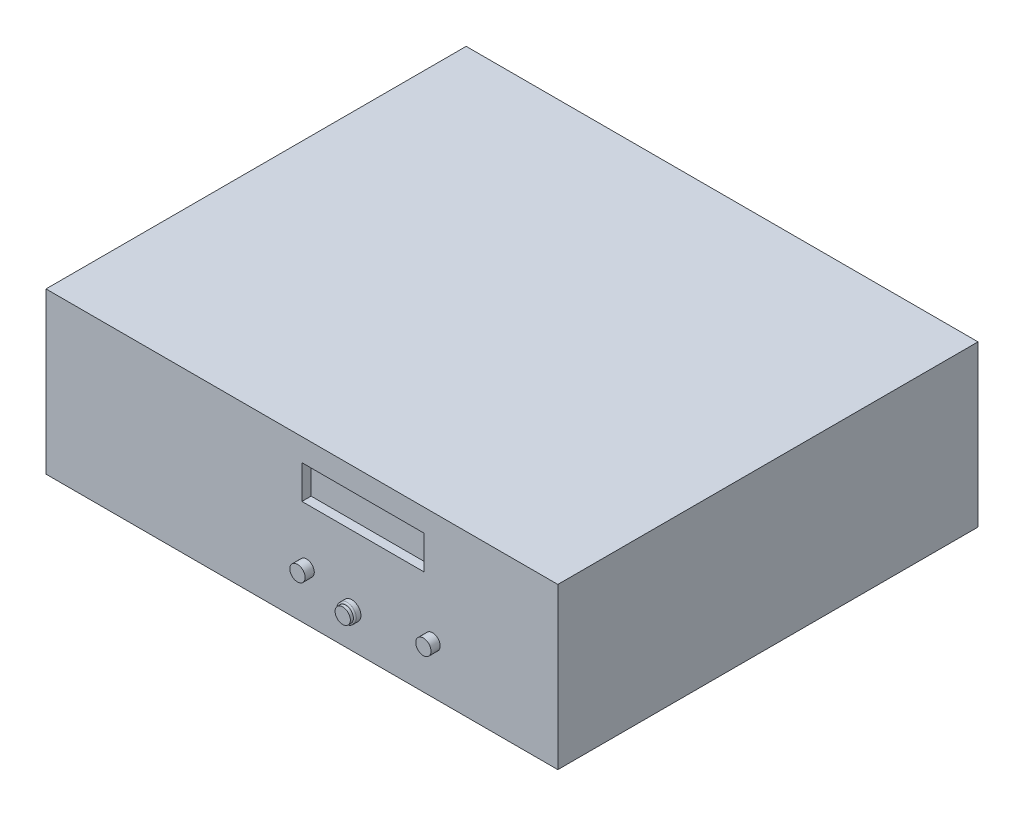
from build123d import *

# Parameters (mm, degrees)
SKETCH1_W           = 425.45
SKETCH1_H           = 349.25
BOSS_EXTRUDE1_DEPTH = 133.35
SKETCH3_W           = 101.611122636
SKETCH3_H           = 27.910351282
CUT_EXTRUDE1_DEPTH  = 7.62
SKETCH4_R           = 6.35
BOSS_EXTRUDE2_DEPTH = 7.62
SKETCH5_R           = 7.62
BOSS_EXTRUDE3_DEPTH = 5.08
FILLET1_SIZE        = 1.27
SKETCH7_R           = 6.35
BOSS_EXTRUDE4_DEPTH = 2.54
SKETCH8_R           = 6.35
BOSS_EXTRUDE5_DEPTH = 7.62


with BuildPart() as part:
    # Sketch1 → Boss-Extrude1 (new body)
    with BuildSketch(Plane(origin=(0, 0, 0), x_dir=(1, 0, 0), z_dir=(0, 1, 0))):
        Rectangle(SKETCH1_W, SKETCH1_H)
    extrude(amount=BOSS_EXTRUDE1_DEPTH)

    # Sketch3 → Cut-Extrude1 (cut)
    with BuildSketch(Plane.XY.offset(174.625)):
        with Locations((50.805561318, 100.690740625)):
            Rectangle(SKETCH3_W, SKETCH3_H)
    extrude(amount=-CUT_EXTRUDE1_DEPTH, mode=Mode.SUBTRACT)

    # Sketch4 → Boss-Extrude2 (add)
    with BuildSketch(Plane.XY.offset(174.625)):
        with Locations(Location((3.924893149, 40.875369667, 0), (0, 0, 180))):
            Circle(SKETCH4_R)
    extrude(amount=BOSS_EXTRUDE2_DEPTH)

    # Sketch5 → Boss-Extrude3 (add)
    with BuildSketch(Plane.XY.offset(174.625)):
        with Locations(Location((41.429427684, 29.10069022, 0), (0, 0, 180))):
            Circle(SKETCH5_R)
    extrude(amount=BOSS_EXTRUDE3_DEPTH)

    # Fillet1
    # a fillet whose section is not a circle: 1.27 mm, written as the material it takes off along each edge
    with BuildSketch(Plane(origin=(41.429427684, 29.10069022, 179.705), x_dir=(-1, 0, 0), z_dir=(0, 1, 0))) as fillet1_piece_1:
        with BuildLine():
            Bezier((7.62, -FILLET1_SIZE), (7.62, 0), (7.62 - FILLET1_SIZE, 0), weights=[1, 3.535533906, 1])
            Line((7.62 - FILLET1_SIZE, 0), (7.62, 0))
            Line((7.62, 0), (7.62, -FILLET1_SIZE))
        make_face()
    revolve(axis=Axis((41.429427684, 29.10069022, 179.705), (0, 0, 1)), mode=Mode.SUBTRACT)

    # Sketch7 → Boss-Extrude4 (add)
    with BuildSketch(Plane.XY.offset(179.705)):
        with Locations(Location((41.536592477, 29.04493903, 0), (0, 0, 241.893573302))):
            Circle(SKETCH7_R)
    extrude(amount=BOSS_EXTRUDE4_DEPTH)

    # Sketch8 → Boss-Extrude5 (add)
    with BuildSketch(Plane.XY.offset(174.625)):
        with Locations(Location((108.588710457, 40.1644131, 0), (0, 0, 180))):
            Circle(SKETCH8_R)
    extrude(amount=BOSS_EXTRUDE5_DEPTH)


solid = part.part
